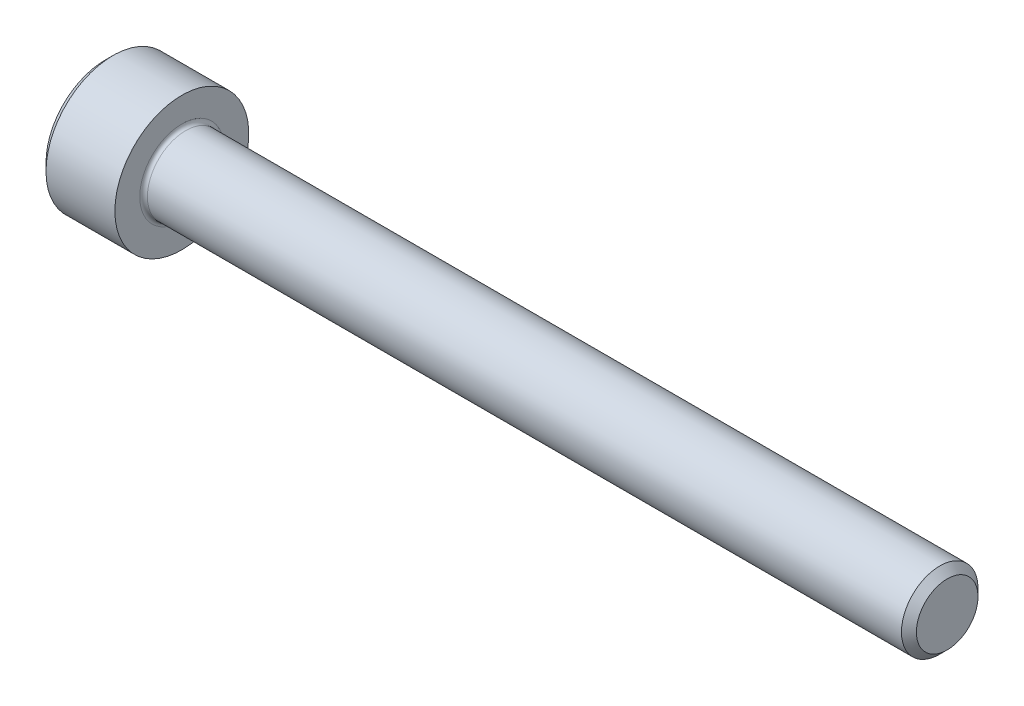
from build123d import *

# Parameters (mm, degrees)
FILLET1_R   = 0.2
HEX_2_DEPTH = 2


with BuildPart() as part:
    # BodySke → Base-Revolve (revolve)
    with BuildSketch(Plane.XY):
        Polygon((0, 0), (0, 3.1), (0.4, 3.5), (4, 3.5), (4, 2), (43.61, 2), (44, 1.61), (44, 0), align=None)
    revolve(axis=Axis((-31.75, 0, 0), (1, 0, 0)))

    # Fillet1
    fillet1_edges = [part.edges().sort_by_distance(p)[0] for p in [
        (4, -2, 0),
    ]]
    fillet(fillet1_edges, radius=FILLET1_R)

    # Sketch2 → Hex-PreBroach (revolve, cut)
    with BuildSketch(Plane.XY):
        Polygon((0, 1.5355), (2, 1.5355), (2.886521338, 0), (0, 0), align=None)
    revolve(axis=Axis((0, 0, 0), (1, 0, 0)), mode=Mode.SUBTRACT)

    # Sketch3 → Hex 2 (cut)
    with BuildSketch(Plane(origin=(0, 0, 0), x_dir=(0, 0.500000000000001, 0.866025403784438), z_dir=(-1, 0, 0))):
        Polygon((0.886521338, 1.5355), (-0.886521338, 1.5355), (-1.773042677, 0), (-0.886521338, -1.5355), (0.886521338, -1.5355), (1.773042677, 0), align=None)
    extrude(amount=-HEX_2_DEPTH, mode=Mode.SUBTRACT)


solid = part.part
